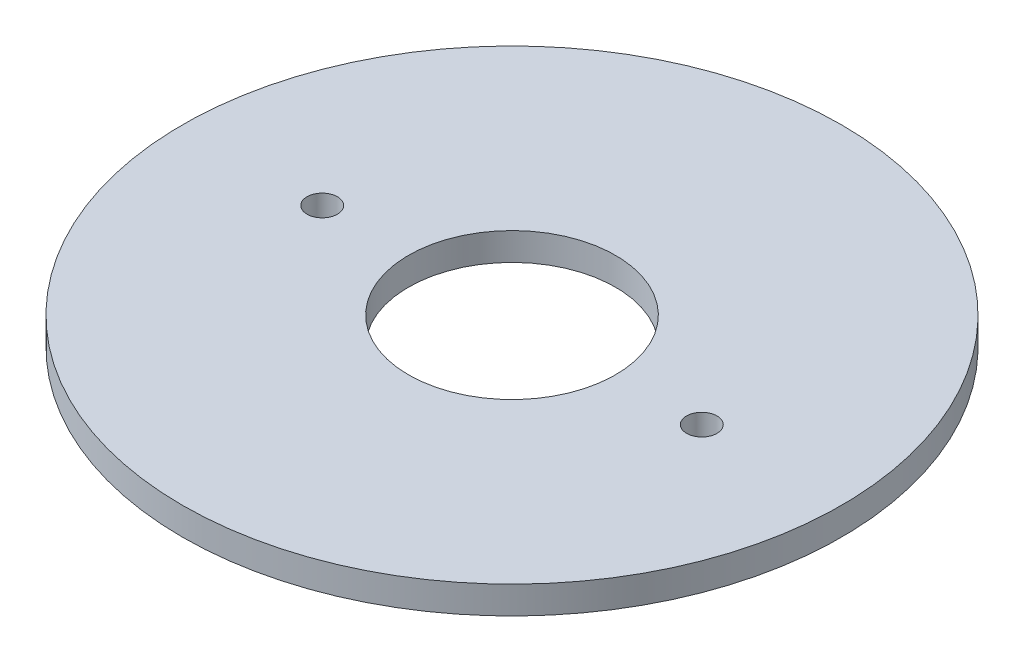
from build123d import *

# Parameters (mm, degrees)
SKETCH1_R           = 47.75
SKETCH1_R_2         = 2.2
SKETCH1_R_3         = 15
BOSS_EXTRUDE1_DEPTH = 4


with BuildPart() as part:
    # Sketch1 → Boss-Extrude1 (new body)
    with BuildSketch(Plane(origin=(0, 0, 0), x_dir=(1, 0, 0), z_dir=(0, 1, 0))):
        Circle(SKETCH1_R)
        with Locations((-27.5, 0)):
            Circle(SKETCH1_R_2, mode=Mode.SUBTRACT)
        with Locations((27.5, 0)):
            Circle(SKETCH1_R_2, mode=Mode.SUBTRACT)
        Circle(SKETCH1_R_3, mode=Mode.SUBTRACT)
    extrude(amount=BOSS_EXTRUDE1_DEPTH)


solid = part.part
